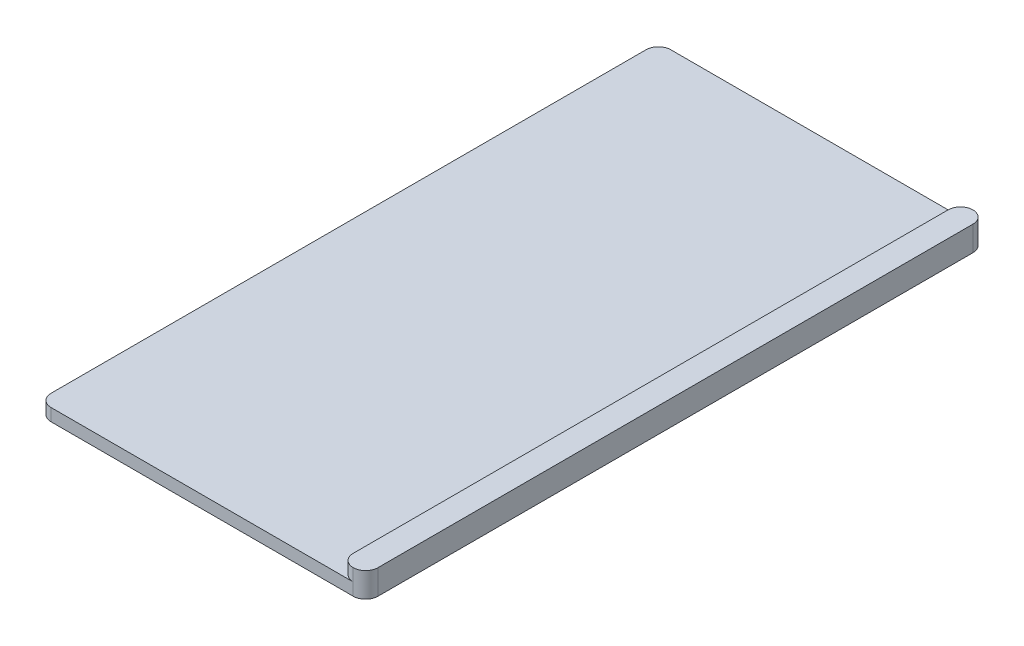
from build123d import *

# Parameters (mm, degrees)
BOSS_EXTRUDE1_DEPTH = 40
FILLET1_R           = 0.8


with BuildPart() as part:
    # Sketch1 → Boss-Extrude1 (new body)
    with BuildSketch(Plane.XY):
        Polygon((0, 0), (21.1, 0), (21.1, 1.6), (19.5, 1.6), (19.5, 0.8), (0, 0.8), align=None)
    extrude(amount=BOSS_EXTRUDE1_DEPTH)

    # Fillet1
    fillet1_edges = [part.edges().sort_by_distance(p)[0] for p in [
        (19.5, 1.2, 0),
        (0, 0.4, 0),
        (21.1, 0.8, 0),
        (19.5, 1.2, 40),
        (21.1, 0.8, 40),
        (0, 0.4, 40),
    ]]
    fillet(fillet1_edges, radius=FILLET1_R - 0.0001)  # a hair under: the kernel refuses the full size


solid = part.part
